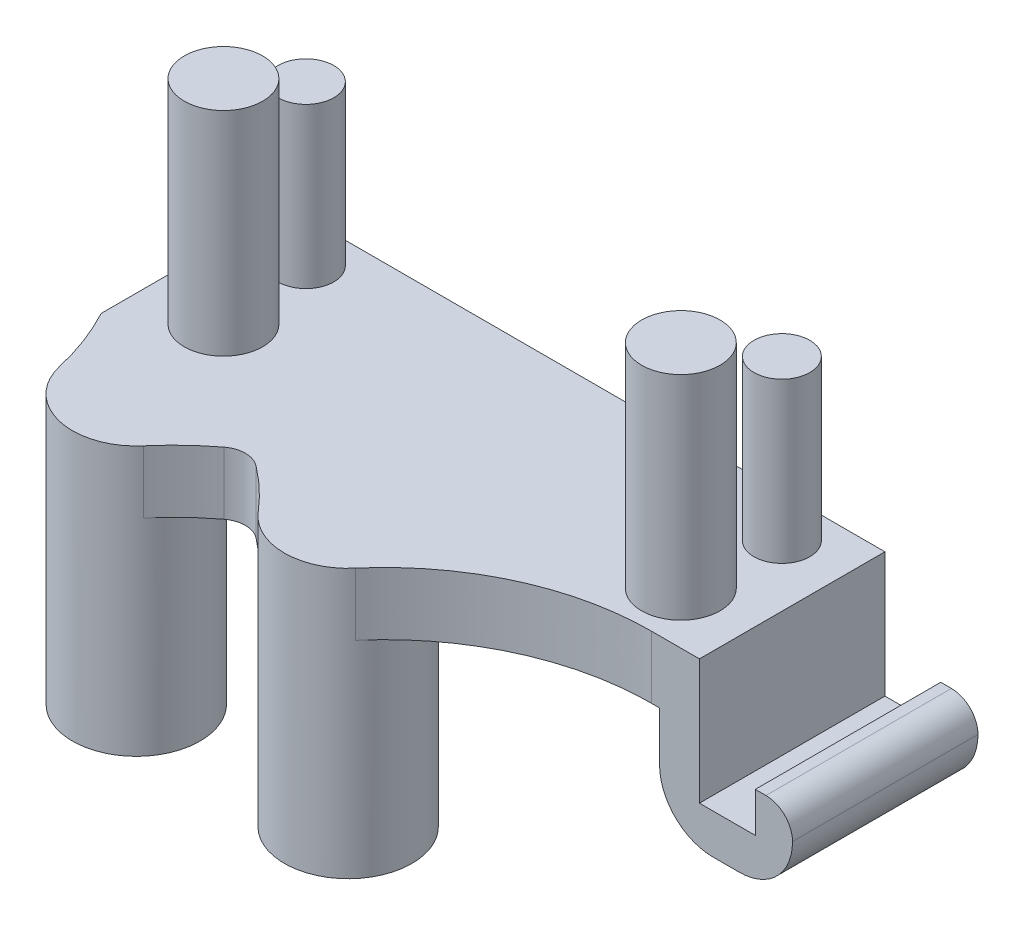
from build123d import *

# Parameters (mm, degrees)
SKETCH1_W                = 22.5
SKETCH1_H                = 6.975
BOSS_EXTRUDE1_DEPTH      = 2.35
SKETCH2_R                = 1.475
BOSS_EXTRUDE2_DEPTH      = 8
SKETCH3_W                = 1.5
SKETCH3_H                = 6.975
BOSS_EXTRUDE3_DEPTH      = 3.85
SKETCH4_W                = 6.975
SKETCH4_H                = 3
BOSS_EXTRUDE4_DEPTH      = 3.5
SKETCH5_W                = 2.1
SKETCH5_H                = 6.975
CUT_EXTRUDE1_DEPTH       = 1.5
SKETCH6_R                = 1.05
BOSS_EXTRUDE5_DEPTH      = 6
BOSS_EXTRUDE9_DEPTH      = 7.76
BOSS_EXTRUDE9_DEPTH_BACK = 2.35
SKETCH7_R                = 2.4
FILLET1_R                = 2
FILLET2_R                = 2
FILLET3_R                = 1
FILLET4_DEPTH            = 2.35
FILLET5_R                = 1


with BuildPart() as part:
    # Sketch1 → Boss-Extrude1 (new body)
    with BuildSketch(Plane(origin=(0, 0, 0), x_dir=(1, 0, 0), z_dir=(0, 1, 0))):
        with Locations((-16.71505467, -8.920455339)):
            Rectangle(SKETCH1_W, SKETCH1_H)
    extrude(amount=BOSS_EXTRUDE1_DEPTH)

    # Sketch2 → Boss-Extrude2 (add)
    with BuildSketch(Plane(origin=(0, 2.35, 0), x_dir=(1, 0, 0), z_dir=(0, 1, 0))):
        with Locations(Location((-25.31505467, -10.457955339, 0), (0, 0, 270))):
            Circle(SKETCH2_R)
        with Locations(Location((-8.11505467, -10.457955339, 0), (0, 0, 270))):
            Circle(SKETCH2_R)
    extrude(amount=BOSS_EXTRUDE2_DEPTH)

    # Sketch3 → Boss-Extrude3 (add)
    with BuildSketch(Plane(origin=(0, 0, 0), x_dir=(-1, 0, 0), z_dir=(0, -1, 0))):
        with Locations((6.21505467, -8.920455339)):
            Rectangle(SKETCH3_W, SKETCH3_H)
    extrude(amount=BOSS_EXTRUDE3_DEPTH)

    # Sketch4 → Boss-Extrude4 (add)
    with BuildSketch(Plane(origin=(-5.46505467, 0, 0), x_dir=(0, 0, -1), z_dir=(1, 0, 0))):
        with Locations((-8.920455339, -2.35)):
            Rectangle(SKETCH4_W, SKETCH4_H)
    extrude(amount=BOSS_EXTRUDE4_DEPTH)

    # Sketch5 → Cut-Extrude1 (cut)
    with BuildSketch(Plane(origin=(0, -0.85, 0), x_dir=(1, 0, 0), z_dir=(0, 1, 0))):
        with Locations((-4.41505467, -8.920455339)):
            Rectangle(SKETCH5_W, SKETCH5_H)
    extrude(amount=-CUT_EXTRUDE1_DEPTH, mode=Mode.SUBTRACT)

    # Sketch6 → Boss-Extrude5 (add)
    with BuildSketch(Plane(origin=(0, 2.35, 0), x_dir=(1, 0, 0), z_dir=(0, 1, 0))):
        with Locations(Location((-7.76505467, -7.007955339, 0), (0, 0, 270))):
            Circle(SKETCH6_R)
        with Locations(Location((-25.66505467, -7.007955339, 0), (0, 0, 270))):
            Circle(SKETCH6_R)
    extrude(amount=BOSS_EXTRUDE5_DEPTH)

    # Sketch7 → Boss-Extrude9 (add, two sides: drawn at the far end of the back side and taken through both)
    with BuildSketch(Plane(origin=(0, 0, 0), x_dir=(-1, 0, 0), z_dir=(0, -1, 0)).offset(-BOSS_EXTRUDE9_DEPTH_BACK)):
        with Locations(Location((16.71505467, -14.367955339, 0), (0, 0, 90))):
            Circle(SKETCH7_R)
        with Locations(Location((24.68505467, -14.367955339, 0), (0, 0, 90))):
            Circle(SKETCH7_R)
    extrude(amount=BOSS_EXTRUDE9_DEPTH + BOSS_EXTRUDE9_DEPTH_BACK)

    # Fillet1
    fillet1_edges = [part.edges().sort_by_distance(p)[0] for p in [
        (-6.96505467, -3.85, 8.920455339),
    ]]
    fillet(fillet1_edges, radius=FILLET1_R)

    # Fillet2
    fillet2_edges = [part.edges().sort_by_distance(p)[0] for p in [
        (-1.96505467, -3.85, 8.920455339),
    ]]
    fillet(fillet2_edges, radius=FILLET2_R)

    # Fillet3
    fillet3_edges = [part.edges().sort_by_distance(p)[0] for p in [
        (-1.96505467, -0.85, 8.920455339),
    ]]
    fillet(fillet3_edges, radius=FILLET3_R - 0.0001)  # a hair under: the kernel refuses the full size

    # Fillet4: read off the stored shape, not the designer's step
    # Fillet4 outline → Fillet4 (add)
    with BuildSketch(Plane(origin=(0, 0, 0), x_dir=(1, 0, 0), z_dir=(0, 1, 0))):
        with BuildLine():
            add(Edge.make_bspline(
                [(-7.274800436, -12.407955339), (-11.89332012, -12.407955339), (-14.887908689, -15.924084371)],
                knots=[0, 0, 0, 1, 1, 1], degree=2, weights=[1, 0.907851061, 1]))
            Line((-7.274800436, -12.407955339), (-15.329991494, -12.407955339))
            ThreePointArc((-15.329991494, -12.407955339), (-14.333802319, -14.068560547), (-14.887908689, -15.924084371))
        make_face()
        with BuildLine():
            add(Edge.make_bspline(
                [(-18.54220065, -15.924084371), (-19.483433236, -14.818925802), (-20.700054672, -14.027012596)],
                knots=[0, 0, 0, 0.335510555, 0.335510555, 0.335510555], degree=2, weights=[1, 0.969083058, 0.958912037]))
            ThreePointArc((-18.54220065, -15.924084371), (-19.096307021, -14.068560547), (-18.100117845, -12.407955339))
            Line((-18.100117845, -12.407955339), (-23.299991494, -12.407955339))
            ThreePointArc((-23.299991494, -12.407955339), (-22.303802319, -14.068560547), (-22.857908689, -15.924084371))
            add(Edge.make_bspline(
                [(-20.700054672, -14.027012596), (-21.916676104, -14.818925803), (-22.857908689, -15.924084371)],
                knots=[0.664489445, 0.664489445, 0.664489445, 1, 1, 1], degree=2, weights=[0.958912037, 0.969083058, 1]))
        make_face()
        with BuildLine():
            ThreePointArc((-27.023832507, -14.906581581), (-26.92727037, -13.512111455), (-26.070117845, -12.407955339))
            Line((-26.070117845, -12.407955339), (-27.96505467, -12.407955339))
            add(Edge.make_bspline(
                [(-27.023832507, -14.906581581), (-27.326152305, -13.59387383), (-27.96505467, -12.407955339)],
                knots=[0, 0, 0, 1, 1, 1], degree=2, weights=[1, 0.991048646, 1]))
        make_face()
    extrude(amount=FILLET4_DEPTH)

    # Fillet5
    fillet5_edges = [part.edges().sort_by_distance(p)[0] for p in [
        (-20.700054672, 1.175, 14.027012596),
    ]]
    fillet(fillet5_edges, radius=FILLET5_R)


solid = part.part
